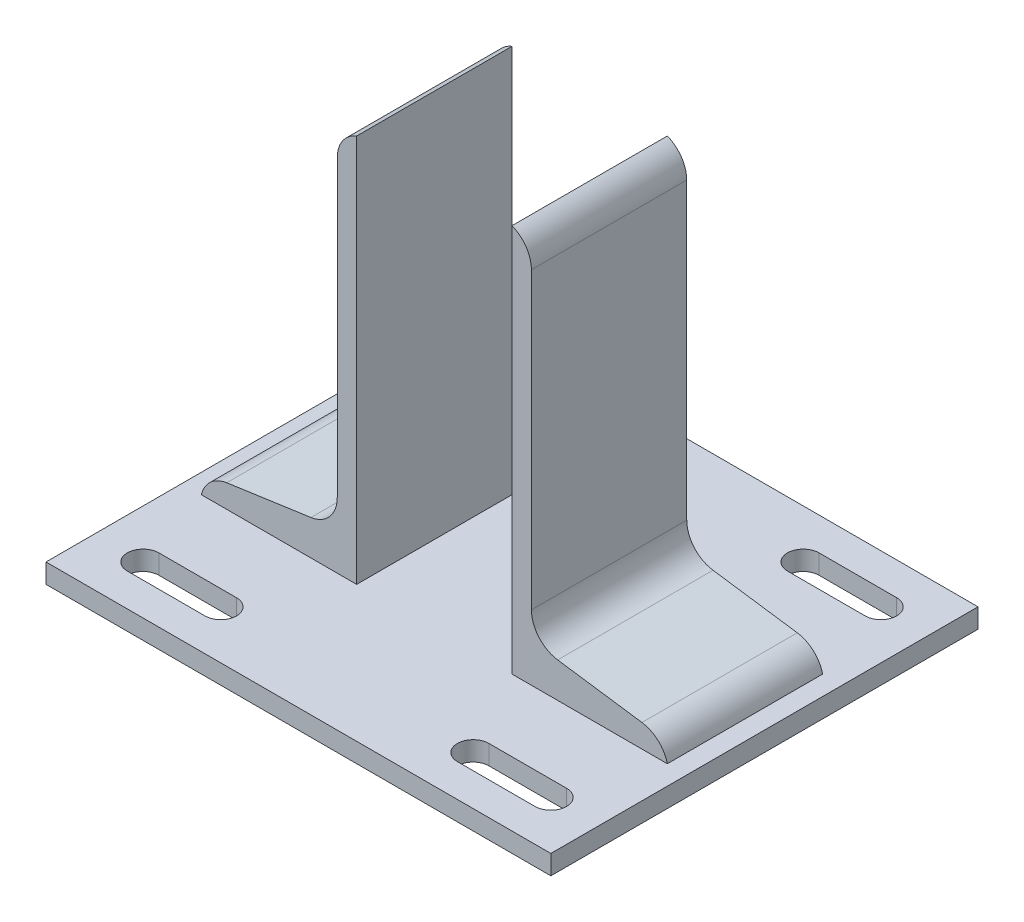
from build123d import *

# Parameters (mm, degrees)
SKETCH1_W           = 165.1
SKETCH1_H           = 139.7
BOSS_EXTRUDE1_DEPTH = 6.35
SKETCH2_W           = 50.8
SKETCH2_H           = 50.8
BOSS_EXTRUDE2_DEPTH = 127
CUT_EXTRUDE1_DEPTH  = 184.491927615
FILLET1_R           = 10
MIRROR6_START       = -25.4
MIRROR6_DEPTH       = 50.8
CUT_EXTRUDE2_DEPTH  = 127


with BuildPart() as part:
    # Sketch1 → Boss-Extrude1 (new body)
    with BuildSketch(Plane(origin=(0, 0, 0), x_dir=(1, 0, 0), z_dir=(0, 1, 0))):
        Rectangle(SKETCH1_W, SKETCH1_H)
    extrude(amount=BOSS_EXTRUDE1_DEPTH)

    # Sketch2 → Boss-Extrude2 (add)
    with BuildSketch(Plane(origin=(0, 6.35, 0), x_dir=(1, 0, 0), z_dir=(0, 1, 0))):
        with Locations((50.8, 0)):
            Rectangle(SKETCH2_W, SKETCH2_H)
    extrude(amount=BOSS_EXTRUDE2_DEPTH)

    # Sketch4 → Cut-Extrude1 (cut, through all)
    with BuildSketch(Plane.XY.offset(25.4)):
        Polygon((31.75, 133.35), (31.75, 19.05), (76.2, 12.7), (95.954687833, 12.7), (95.954687833, 161.138699607), (31.75, 161.138699607), align=None)
    extrude(amount=-CUT_EXTRUDE1_DEPTH, mode=Mode.SUBTRACT)

    # Fillet1
    # the kernel refuses this fillet: 10 mm, written as the material it adds along each edge
    with BuildSketch(Plane(origin=(31.75, 19.05, 25.4), x_dir=(0.9899494936611666, -0.14142135623730998, 0), z_dir=(0, 0, -1))) as fillet1_piece_1:
        with BuildLine():
            CenterArc((FILLET1_R * 0.867295401695, -FILLET1_R), FILLET1_R, 90, 81.869897646)
            Line((-FILLET1_R * 0.122654091966, -FILLET1_R * 0.858578643763), (0, 0))
            Line((0, 0), (FILLET1_R * 0.867295401695, 0))
        make_face()
    extrude(amount=50.8)
    # the kernel refuses this fillet: 10 mm, written as the material it takes off along each edge
    with BuildSketch(Plane(origin=(76.2, 12.7, 46.366939289), x_dir=(0, -1, 0), z_dir=(0, 0, -1))) as fillet1_2_piece_1:
        with BuildLine():
            CenterArc((8.71342574, 9.716697935), FILLET1_R, 188.130102354, 68.199121512)
            Line((-1.186069196, 8.302484373), (0, 0))
            Line((0, 0), (6.35, 0))
        make_face()
    extrude(amount=92.733878578, mode=Mode.SUBTRACT)
    with BuildSketch(Plane(origin=(31.75, 133.35, 48.675187969), x_dir=(-1, 0, 0), z_dir=(0, 0, -1))) as fillet1_2_piece_2:
        with BuildLine():
            CenterArc((10, -9.310075188), FILLET1_R, 111.407582704, 68.592417296)
            Line((0, -9.310075188), (0, 0))
            Line((0, 0), (6.35, 0))
        make_face()
    extrude(amount=97.350375938, mode=Mode.SUBTRACT)

    # Mirror6: read off the stored shape, not the designer's step
    # Mirror6 outline → Mirror6 (add)
    with BuildSketch(Plane.XY.offset(MIRROR6_START)):
        with BuildLine():
            Line((-76.2, 6.35), (-25.4, 6.35))
            Line((-25.4, 6.35), (-25.4, 133.35))
            ThreePointArc((-25.4, 133.35), (-30.011355821, 129.674638647), (-31.75, 124.039924812))
            Line((-31.75, 124.039924812), (-31.75, 27.722954017))
            ThreePointArc((-31.75, 27.722954017), (-34.19546045, 21.170936603), (-40.335786438, 17.82345908))
            Line((-40.335786438, 17.82345908), (-67.897515627, 13.886069196))
            ThreePointArc((-67.897515627, 13.886069196), (-73.204342343, 11.391141605), (-76.2, 6.35))
        make_face()
    extrude(amount=MIRROR6_DEPTH)

    # Sketch6 → Cut-Extrude2 (cut)
    with BuildSketch(Plane(origin=(0, 6.35, 0), x_dir=(-1, 0, 0), z_dir=(0, 1, 0))):
        with BuildLine():
            Line((-41.275, 48.8188), (-66.675, 48.8188))
            ThreePointArc((-66.675, 48.8188), (-71.8312, 53.975), (-66.675, 59.1312))
            Line((-66.675, 59.1312), (-41.275, 59.1312))
            ThreePointArc((-41.275, 59.1312), (-36.1188, 53.975), (-41.275, 48.8188))
        make_face()
        with BuildLine():
            Line((-41.275, -59.1312), (-66.675, -59.1312))
            ThreePointArc((-66.675, -59.1312), (-71.8312, -53.975), (-66.675, -48.8188))
            Line((-66.675, -48.8188), (-41.275, -48.8188))
            ThreePointArc((-41.275, -48.8188), (-36.1188, -53.975), (-41.275, -59.1312))
        make_face()
        with BuildLine():
            Line((41.275, 59.1312), (66.675, 59.1312))
            ThreePointArc((66.675, 59.1312), (71.8312, 53.975), (66.675, 48.8188))
            Line((66.675, 48.8188), (41.275, 48.8188))
            ThreePointArc((41.275, 48.8188), (36.1188, 53.975), (41.275, 59.1312))
        make_face()
        with BuildLine():
            Line((41.275, -48.8188), (66.675, -48.8188))
            ThreePointArc((66.675, -48.8188), (71.8312, -53.975), (66.675, -59.1312))
            Line((66.675, -59.1312), (41.275, -59.1312))
            ThreePointArc((41.275, -59.1312), (36.1188, -53.975), (41.275, -48.8188))
        make_face()
    extrude(amount=-CUT_EXTRUDE2_DEPTH, mode=Mode.SUBTRACT)


solid = part.part
